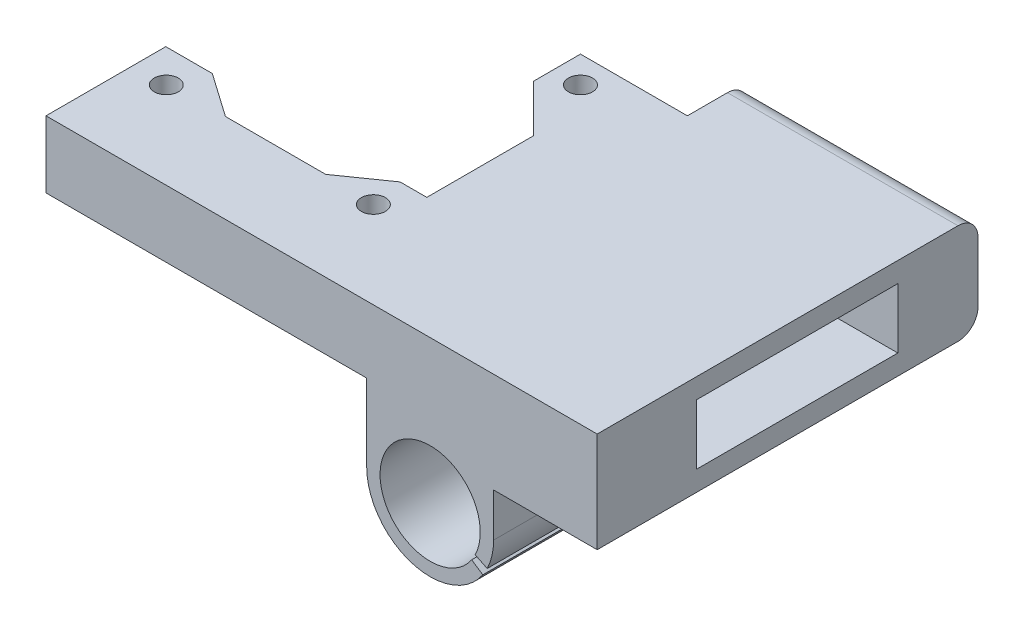
from build123d import *

# Parameters (mm, degrees)
SKETCH1_R               = 1.8
BOSS_EXTRUDE1_DEPTH     = 31
CUT_EXTRUDE1_DEPTH      = 16
FILLET1_R               = 3
CUT_EXTRUDE2_DEPTH      = 101.35561768
CUT_EXTRUDE2_DEPTH_BACK = 101.35561768
SKETCH5_W               = 48
SKETCH5_H               = 48
CUT_EXTRUDE3_DEPTH      = 21
SKETCH6_W               = 30.142
SKETCH6_H               = 9
CUT_EXTRUDE4_DEPTH      = 31.4
SKETCH7_W               = 21
SKETCH7_H               = 9
CUT_EXTRUDE5_DEPTH      = 83.590616969
SKETCH8_R               = 3.5
CUT_EXTRUDE6_DEPTH      = 1.5


with BuildPart() as part:
    # Sketch1 → Boss-Extrude1 (new body)
    with BuildSketch(Plane(origin=(0, 0, 0), x_dir=(1, 0, 0), z_dir=(0, 1, 0))):
        Polygon((0, 17.928932188), (0, 0), (82.5, 0), (82.5, 57), (48, 57), (48, 48), (32, 48), (32, 41), (39.071067812, 33.928932188), (39.071067812, 17.928932188), (35.071067812, 17.928932188), (28.517851458, 13.340320697), (13.517851458, 13.340320697), (6.964635103, 17.928932188), align=None)
        with Locations((5, 13)):
            Circle(SKETCH1_R, mode=Mode.SUBTRACT)
        with Locations((36, 13)):
            Circle(SKETCH1_R, mode=Mode.SUBTRACT)
        with Locations((36, 44)):
            Circle(SKETCH1_R, mode=Mode.SUBTRACT)
    extrude(amount=BOSS_EXTRUDE1_DEPTH)

    # Sketch2 → Cut-Extrude1 (cut)
    with BuildSketch(Plane.XZ):
        Polygon((82.5, -57), (82.5, 0), (67, 0), (67, -48), (48, -48), (48, -57), align=None)
    extrude(amount=-CUT_EXTRUDE1_DEPTH, mode=Mode.SUBTRACT)

    # Fillet1
    fillet1_edges = [part.edges().sort_by_distance(p)[0] for p in [
        (65.25, 31, -57),
        (65.25, 16, -57),
    ]]
    fillet(fillet1_edges, radius=FILLET1_R)

    # Sketch3 → Cut-Extrude2 (cut, two sides: drawn at the far end of the back side and taken through both)
    with BuildSketch(Plane(origin=(0, 0, -48), x_dir=(-1, 0, 0), z_dir=(0, 0, -1)).offset(-CUT_EXTRUDE2_DEPTH_BACK)):
        with BuildLine():
            Line((-65.375856939, 4.187667417), (-63.717781794, 5.306053224))
            ThreePointArc((-63.717781794, 5.306053224), (-51.004809472, 13.25), (-64.240955347, 6.212216399))
            Line((-64.240955347, 6.212216399), (-66.03854344, 5.335474106))
            ThreePointArc((-66.03854344, 5.335474106), (-66.756515615, 7.362964984), (-67, 9.5))
            Line((-67, 9.5), (-67, 0))
            Line((-67, 0), (-57.5, 0))
            ThreePointArc((-57.5, 0), (-61.959979846, 1.111997868), (-65.375856939, 4.187667417))
        make_face()
        with BuildLine():
            ThreePointArc((-48, 9.5), (-50.782485579, 2.782485579), (-57.5, 0))
            Line((-57.5, 0), (-48, 0))
            Line((-48, 0), (-48, 9.5))
        make_face()
    extrude(amount=CUT_EXTRUDE2_DEPTH + CUT_EXTRUDE2_DEPTH_BACK, mode=Mode.SUBTRACT)

    # Sketch5 → Cut-Extrude3 (cut)
    with BuildSketch(Plane.XZ):
        with Locations((24, -24)):
            Rectangle(SKETCH5_W, SKETCH5_H)
    extrude(amount=-CUT_EXTRUDE3_DEPTH, mode=Mode.SUBTRACT)

    # Sketch6 → Cut-Extrude4 (cut)
    with BuildSketch(Plane(origin=(82.5, 0, 0), x_dir=(0, 0, -1), z_dir=(1, 0, 0))):
        with Locations((29.929, 23.5)):
            Rectangle(SKETCH6_W, SKETCH6_H)
    extrude(amount=-CUT_EXTRUDE4_DEPTH, mode=Mode.SUBTRACT)

    # Sketch7 → Cut-Extrude5 (cut, through all)
    with BuildSketch(Plane(origin=(51.1, 0, 0), x_dir=(0, 0, -1), z_dir=(1, 0, 0))):
        with Locations((28.428932188, 23.5)):
            Rectangle(SKETCH7_W, SKETCH7_H)
    extrude(amount=-CUT_EXTRUDE5_DEPTH, mode=Mode.SUBTRACT)

    # Sketch8 → Cut-Extrude6 (cut)
    with BuildSketch(Plane.XZ.offset(-21)):
        with Locations((5, -13)):
            Circle(SKETCH8_R)
        with Locations((36, -13)):
            Circle(SKETCH8_R)
        with Locations((36, -44)):
            Circle(SKETCH8_R)
    extrude(amount=-CUT_EXTRUDE6_DEPTH, mode=Mode.SUBTRACT)


solid = part.part
